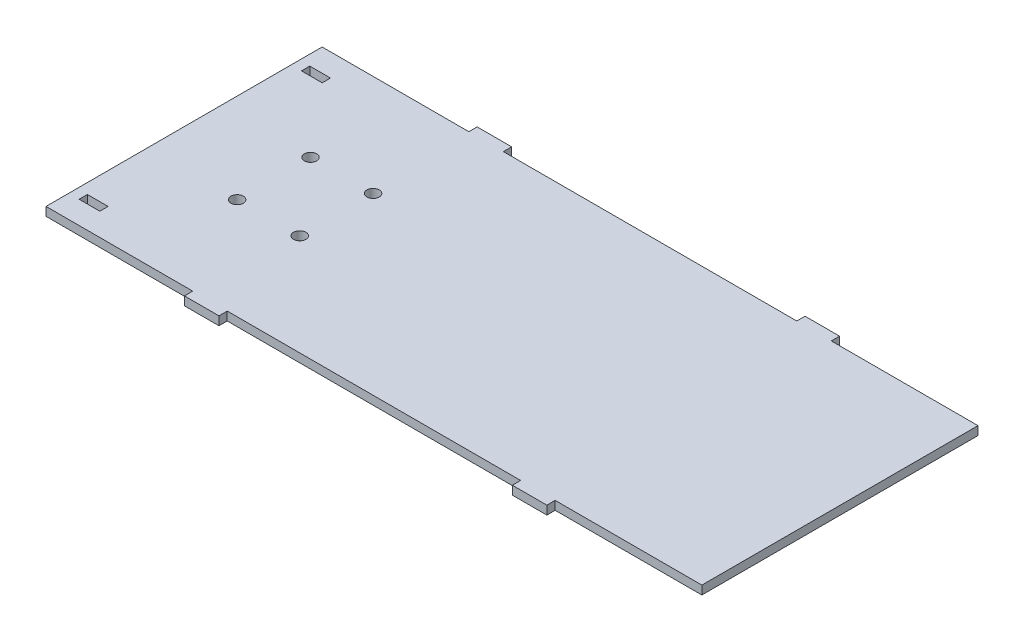
from build123d import *

# Parameters (mm, degrees)
MAIN_FRAME_DEPTH   = 3.175
SKETCH2_R          = 2.276969522
FRONT_WHEEL_DEPTH  = 252.434374199
SKETCH4_W          = 7.62
SKETCH4_H          = 3.048
SENSOR_HOLES_DEPTH = 252.434374199


with BuildPart() as part:
    # Sketch1 → Main Frame (new body)
    with BuildSketch(Plane(origin=(0, 0, 0), x_dir=(1, 0, 0), z_dir=(0, 1, 0))):
        Polygon((0, 0), (41.275, 0), (41.275, -3.048), (53.975, -3.048), (53.975, 0), (161.925, 0), (161.925, -3.048), (174.625, -3.048), (174.625, 0), (228.6, 0), (228.6, 101.6), (174.625, 101.6), (174.625, 104.648), (161.925, 104.648), (161.925, 101.6), (53.975, 101.6), (53.975, 104.648), (41.275, 104.648), (41.275, 101.6), (0, 101.6), (-12.7, 101.6), (-12.7, 0), align=None)
    extrude(amount=MAIN_FRAME_DEPTH)

    # Sketch2 → Front Wheel (cut, through all)
    with BuildSketch(Plane(origin=(0, 3.175, 0), x_dir=(1, 0, 0), z_dir=(0, 1, 0))):
        with Locations((20.32, 64.29375)):
            Circle(SKETCH2_R)
        with Locations((43.33875, 64.29375)):
            Circle(SKETCH2_R)
        with Locations((43.33875, 37.30625)):
            Circle(SKETCH2_R)
        with Locations((20.32, 37.30625)):
            Circle(SKETCH2_R)
    extrude(amount=-FRONT_WHEEL_DEPTH, mode=Mode.SUBTRACT)

    # Sketch4 → Sensor Holes (cut, through all)
    with BuildSketch(Plane(origin=(0, 3.175, 0), x_dir=(1, 0, 0), z_dir=(0, 1, 0))):
        with Locations((-5.08, 91.707882035)):
            Rectangle(SKETCH4_W, SKETCH4_H)
        with Locations((-5.08, 9.892117965)):
            Rectangle(SKETCH4_W, SKETCH4_H)
    extrude(amount=-SENSOR_HOLES_DEPTH, mode=Mode.SUBTRACT)


solid = part.part
